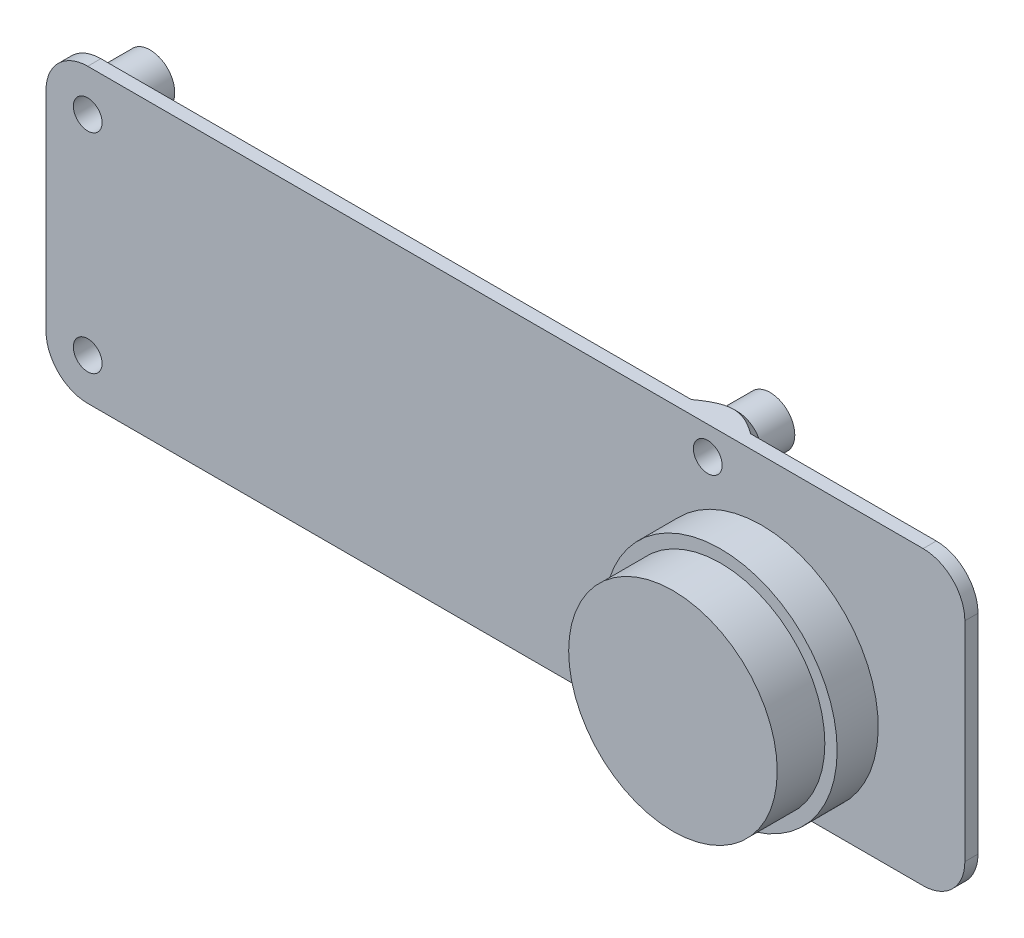
from build123d import *
from build123d.topology import SkipClean

# Parameters (mm, degrees)
SKETCH1_R           = 1.75
BOSS_EXTRUDE1_DEPTH = 1.6
SKETCH2_R           = 12.7
BOSS_EXTRUDE2_DEPTH = 10.8
BOSS_EXTRUDE3_START = 6
SKETCH3_R           = 3
SKETCH3_R_2         = 1.75
BOSS_EXTRUDE3_DEPTH = 6
SKETCH4_R           = 14.2
SKETCH4_R_2         = 12.7
BOSS_EXTRUDE4_DEPTH = 5
CHAMFER1_SIZE       = 2


with BuildPart() as part:
    # Sketch1 → Boss-Extrude1 (new body)
    with BuildSketch(Plane.XY):
        with BuildLine():
            Line((0, 5.08), (101.74, 5.08))
            ThreePointArc((101.74, 5.08), (105.332102448, 3.592102448), (106.82, 0))
            Line((106.82, 0), (106.82, -25.4))
            ThreePointArc((106.82, -25.4), (105.332102448, -28.992102448), (101.74, -30.48))
            Line((101.74, -30.48), (0, -30.48))
            ThreePointArc((0, -30.48), (-3.592102448, -28.992102448), (-5.08, -25.4))
            Line((-5.08, -25.4), (-5.08, 0))
            ThreePointArc((-5.08, 0), (-3.592102448, 3.592102448), (0, 5.08))
        make_face()
        Circle(SKETCH1_R, mode=Mode.SUBTRACT)
        with Locations((0, -25.4)):
            Circle(SKETCH1_R, mode=Mode.SUBTRACT)
        with Locations((75.51, 1.63)):
            Circle(SKETCH1_R, mode=Mode.SUBTRACT)
        with Locations((64.33, -27.48)):
            Circle(SKETCH1_R, mode=Mode.SUBTRACT)
    extrude(amount=BOSS_EXTRUDE1_DEPTH)

    # Sketch2 → Boss-Extrude2 (add)
    with BuildSketch(Plane.XY.offset(1.6)):
        with Locations(Location((82.07, -16.48, 0), (0, 0, 180))):
            Circle(SKETCH2_R)
    extrude(amount=BOSS_EXTRUDE2_DEPTH)

    # Sketch3 → Boss-Extrude3 (add)
    # profile 1 of 4: a face of its own
    with SkipClean():  # the faces are left unmerged after this step: merging them gives an invalid solid
        with BuildSketch(Plane(origin=(0, 0, 0), x_dir=(-1, 0, 0), z_dir=(0, 0, -1)).offset(BOSS_EXTRUDE3_START)):
            with Locations(Location((-75.51, 1.63, 0), (0, 0, 180))):
                Circle(SKETCH3_R)
            with Locations((-75.51, 1.63)):
                Circle(SKETCH3_R_2, mode=Mode.SUBTRACT)
        # profile 2 of 4: a face of its own
        with BuildSketch(Plane(origin=(0, 0, 0), x_dir=(-1, 0, 0), z_dir=(0, 0, -1)).offset(BOSS_EXTRUDE3_START)):
            with Locations(Location((-64.33, -27.48, 0), (0, 0, 270))):
                Circle(SKETCH3_R)
            with Locations((-64.33, -27.48)):
                Circle(SKETCH3_R_2, mode=Mode.SUBTRACT)
        # profile 3 of 4: a face of its own
        with BuildSketch(Plane(origin=(0, 0, 0), x_dir=(-1, 0, 0), z_dir=(0, 0, -1)).offset(BOSS_EXTRUDE3_START)):
            with Locations(Location((0, -25.4, 0), (0, 0, 180))):
                Circle(SKETCH3_R)
            with Locations((0, -25.4)):
                Circle(SKETCH3_R_2, mode=Mode.SUBTRACT)
        # profile 4 of 4: a face of its own
        with BuildSketch(Plane(origin=(0, 0, 0), x_dir=(-1, 0, 0), z_dir=(0, 0, -1)).offset(BOSS_EXTRUDE3_START)):
            with Locations(Location((0, 0, 0), (0, 0, 180))):
                Circle(SKETCH3_R)
            Circle(SKETCH3_R_2, mode=Mode.SUBTRACT)
        extrude(amount=-BOSS_EXTRUDE3_DEPTH)

    # Sketch4 → Boss-Extrude4 (add)
    with SkipClean():  # the faces are left unmerged after this step: merging them gives an invalid solid
        with BuildSketch(Plane.XY.offset(1.6)):
            with Locations(Location((82.07, -16.48, 0), (0, 0, 260.372367317))):
                Circle(SKETCH4_R)
            with Locations(Location((82.07, -16.48, 0), (0, 0, 180))):
                Circle(SKETCH4_R_2, mode=Mode.SUBTRACT)
        extrude(amount=BOSS_EXTRUDE4_DEPTH)

    # Chamfer1
    # the kernel refuses this chamfer: 2 mm, written as the material it adds along each edge
    with BuildSketch(Plane(origin=(75.51, 1.63, 0), x_dir=(1, 0, 0), z_dir=(0, 1, 0))) as chamfer1_piece_1_section:
        Polygon((3 + CHAMFER1_SIZE, 0), (3, CHAMFER1_SIZE), (3, 0), align=None)
    chamfer1_piece_1 = revolve(axis=Axis((75.51, 1.63, 0), (0, 0, -1)), mode=Mode.PRIVATE)
    chamfer1_piece_1 = split(chamfer1_piece_1, bisect_by=Plane(origin=(71.534469878, 5.08, -0.975530122), z_dir=(0, -1, 0)), keep=Keep.TOP, mode=Mode.PRIVATE)
    add(chamfer1_piece_1)
    with BuildSketch(Plane(origin=(64.33, -27.48, 0), x_dir=(0, -1, 0), z_dir=(1, 0, 0))) as chamfer1_piece_2_section:
        Polygon((3 + CHAMFER1_SIZE, 0), (3, CHAMFER1_SIZE), (3, 0), align=None)
    chamfer1_piece_2 = revolve(axis=Axis((64.33, -27.48, 0), (0, 0, -1)), mode=Mode.PRIVATE)
    chamfer1_piece_2 = split(chamfer1_piece_2, bisect_by=Plane(origin=(64.33, -30.48, -0.976321061), z_dir=(0, 1, 0)), keep=Keep.TOP, mode=Mode.PRIVATE)
    add(chamfer1_piece_2)
    with BuildSketch(Plane(origin=(0, -25.4, 0), x_dir=(1, 0, 0), z_dir=(0, 1, 0))) as chamfer1_piece_3:
        Polygon((3 + CHAMFER1_SIZE, 0), (3, CHAMFER1_SIZE), (3, 0), align=None)
    revolve(axis=Axis((0, -25.4, 0), (0, 0, -1)))
    with BuildSketch(Plane(origin=(0, 0, 0), x_dir=(1, 0, 0), z_dir=(0, 1, 0))) as chamfer1_piece_4:
        Polygon((3 + CHAMFER1_SIZE, 0), (3, CHAMFER1_SIZE), (3, 0), align=None)
    revolve(axis=Axis((0, 0, 0), (0, 0, -1)))


solid = part.part
